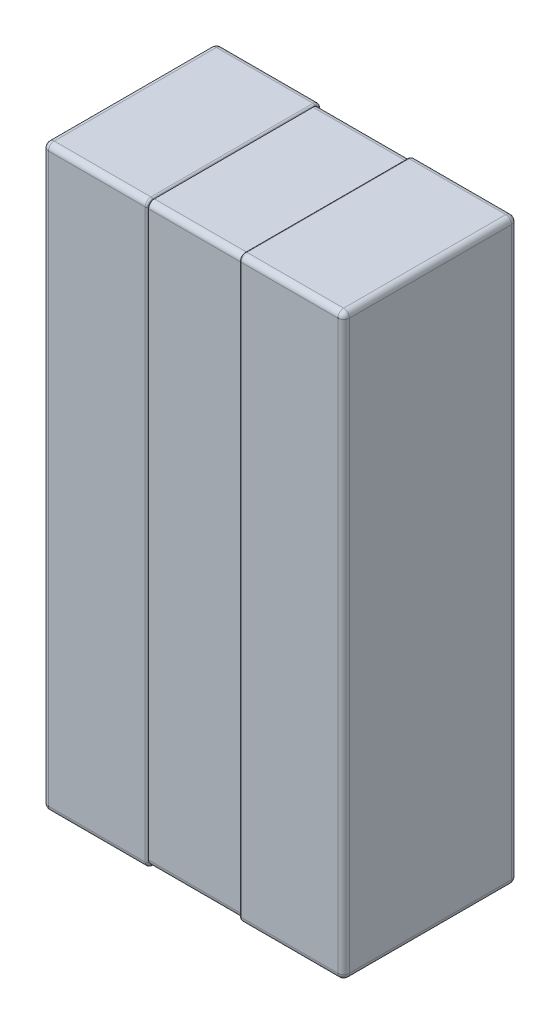
from build123d import *

# Parameters (mm, degrees)
SKETCH1_W                           = 0.52
SKETCH1_H                           = 1
ALL_BODY_DEPTH                      = 0.3
CUT_OUT_THE_BODY_FOR_PIN_DEPTH      = 0.08
CUT_OUT_THE_BODY_FOR_PIN_DEPTH_BACK = 0.08
SKETCH2_OUTSIDE_W                   = 2.534
SKETCH2_OUTSIDE_H                   = 3.234
SKETCH2_OUTSIDE_W_2                 = 0.294
SKETCH2_OUTSIDE_H_2                 = 0.994
BODY_FILLET_R                       = 0.01
PIN_FILLET_A_R                      = 0.01
PIN_FILLET_B_R                      = 0.003


with BuildPart() as part:
    # Sketch1 → All body (new body)
    with BuildSketch(Plane.XY):
        Rectangle(SKETCH1_W, SKETCH1_H)
    extrude(amount=ALL_BODY_DEPTH)

    # Sketch2 outside → Cut out the body for pin (cut, two sides: drawn at the far end of the back side and taken through both)
    with BuildSketch(Plane(origin=(0, 0, 0), x_dir=(0, 0, -1), z_dir=(1, 0, 0)).offset(-CUT_OUT_THE_BODY_FOR_PIN_DEPTH_BACK)):
        with Locations((-0.15, 0)):
            Rectangle(SKETCH2_OUTSIDE_W, SKETCH2_OUTSIDE_H)
        with Locations((-0.15, 0)):
            Rectangle(SKETCH2_OUTSIDE_W_2, SKETCH2_OUTSIDE_H_2, mode=Mode.SUBTRACT)
    extrude(amount=CUT_OUT_THE_BODY_FOR_PIN_DEPTH + CUT_OUT_THE_BODY_FOR_PIN_DEPTH_BACK, mode=Mode.SUBTRACT)

    # Body fillet
    body_fillet_edges = [part.edges().sort_by_distance(p)[0] for p in [
        (0, 0.497, 0.003),
        (0, 0.497, 0.297),
        (0, -0.497, 0.297),
        (0, -0.497, 0.003),
    ]]
    fillet(body_fillet_edges, radius=BODY_FILLET_R)

    # Pin fillet a
    pin_fillet_a_edges = [part.edges().sort_by_distance(p)[0] for p in [
        (0.26, 0, 0.3),
        (-0.17, 0.5, 0),
        (0.17, -0.5, 0),
        (0.17, -0.5, 0.3),
        (-0.17, 0.5, 0.3),
        (0.17, 0.5, 0.3),
        (-0.26, 0, 0.3),
        (0.17, 0.5, 0),
        (0.26, 0, 0),
        (-0.17, -0.5, 0),
        (-0.26, 0, 0),
        (-0.26, 0.5, 0.15),
        (0.26, 0.5, 0.15),
        (0.26, -0.5, 0.15),
        (-0.26, -0.5, 0.15),
        (-0.17, -0.5, 0.3),
    ]]
    fillet(pin_fillet_a_edges, radius=PIN_FILLET_A_R)

    # Pin fillet b
    pin_fillet_b_edges = [part.edges().sort_by_distance(p)[0] for p in [
        (0.08, -0.5, 0.15),
        (0.08, 0, 0.3),
        (0.08, 0.5, 0.15),
        (0.08, 0, 0),
        (-0.08, 0.5, 0.15),
        (-0.08, 0, 0.3),
        (-0.08, -0.5, 0.15),
        (-0.08, 0, 0),
        (0.08, 0.497071068, 0.002928932),
        (0.08, -0.497071068, 0.002928932),
        (0.08, -0.497071068, 0.297071068),
        (0.08, 0.497071068, 0.297071068),
        (-0.08, -0.497071068, 0.297071068),
        (-0.08, 0.497071068, 0.297071068),
        (-0.08, -0.497071068, 0.002928932),
        (-0.08, 0.497071068, 0.002928932),
    ]]
    fillet(pin_fillet_b_edges, radius=PIN_FILLET_B_R - 0.0001)  # a hair under: the kernel refuses the full size


solid = part.part
